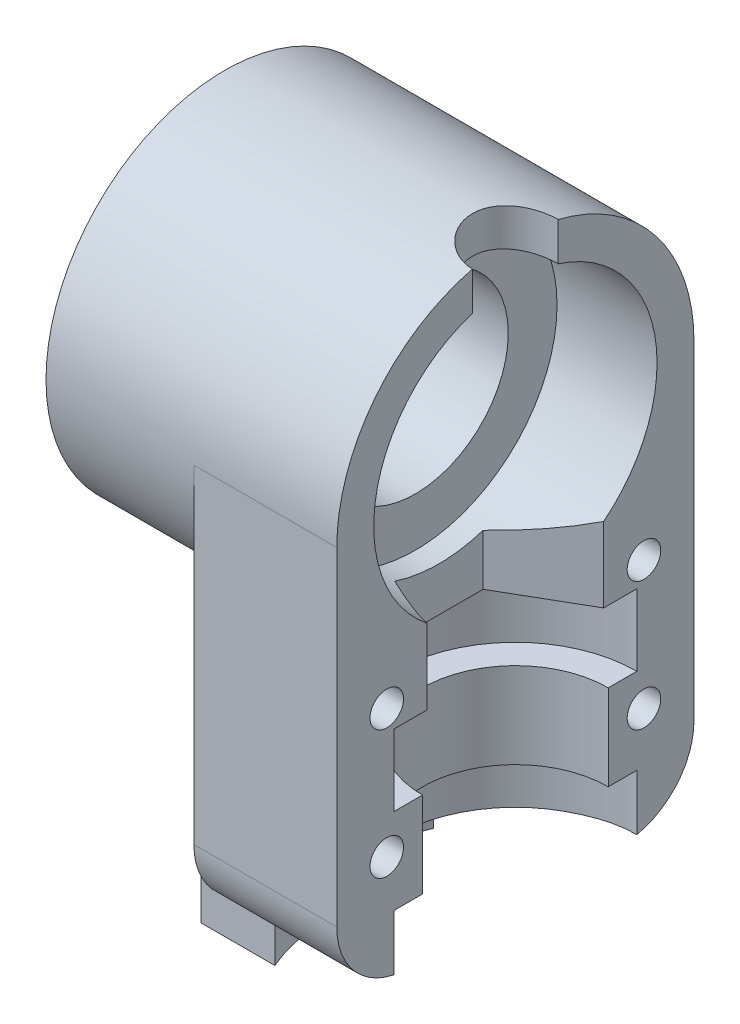
from build123d import *

# Parameters (mm, degrees)
CROQUIS1_W              = 10
CROQUIS1_H              = 25
SALIENTE_EXTRUIR1_DEPTH = 28
CROQUIS2_R              = 12.5
SALIENTE_EXTRUIR2_DEPTH = 12
REDONDEO1_R             = 5
CORTAR_EXTRUIR1_DEPTH   = 13
CROQUIS5_R              = 9.915
CORTAR_EXTRUIR2_DEPTH   = 7
CROQUIS8_R              = 1.175
CORTAR_EXTRUIR5_DEPTH   = 50.08411164
CROQUIS10_W             = 7
CROQUIS10_H             = 15
SALIENTE_EXTRUIR3_DEPTH = 5
CORTAR_EXTRUIR6_DEPTH   = 7
CORTAR_EXTRUIR7_DEPTH   = 3.85
CHAFL_N1_SIZE           = 4.3
CHAFL_N1_SIZE2          = 5.124540448
REDONDEO2_R             = 1
CORTAR_EXTRUIR8_DEPTH   = 4
REDONDEO3_R             = 3
CROQUIS14_R             = 12.5
CROQUIS14_R_2           = 11.25
SALIENTE_EXTRUIR4_DEPTH = 7.35
CROQUIS15_R             = 12.5
CROQUIS15_R_2           = 11
SALIENTE_EXTRUIR5_DEPTH = 1
CHAFL_N2_SIZE           = 0.5
CHAFL_N3_SIZE           = 0.5
CROQUIS16_R             = 6.5
CORTAR_EXTRUIR9_DEPTH   = 50.43149313


# Some blends are built 0.0001 mm under size
with BuildPart() as part:
    # Croquis1 → Saliente-Extruir1 (new body)
    with BuildSketch(Plane(origin=(0, 0, 0), x_dir=(1, 0, 0), z_dir=(0, 1, 0))):
        with Locations((-5, 12.5)):
            Rectangle(CROQUIS1_W, CROQUIS1_H)
    extrude(amount=SALIENTE_EXTRUIR1_DEPTH)

    # Croquis2 → Saliente-Extruir2 (add)
    with BuildSketch(Plane(origin=(0, 0, 0), x_dir=(0, 0, -1), z_dir=(1, 0, 0))):
        with Locations((12.5, 28)):
            Circle(CROQUIS2_R)
    extrude(amount=-SALIENTE_EXTRUIR2_DEPTH)

    # Croquis3 → Cortar-Revolución1 (revolve, cut)
    with BuildSketch(Plane(origin=(0, 0, 0), x_dir=(0, 0, -1), z_dir=(1, 0, 0))):
        Polygon((21, 0.5), (21, 4), (19, 4), (19, 10), (21, 10), (21, 15), (15.5, 15), (15.5, 41), (12.5, 41), (12.5, 0), (21, 0), align=None)
    revolve(axis=Axis((0, 0, -12.5), (0, 1, 0)), mode=Mode.SUBTRACT)

    # Redondeo1
    redondeo1_edges = [part.edges().sort_by_distance(p)[0] for p in [
        (-5, 0, -25),
        (-5, 0, 0),
    ]]
    fillet(redondeo1_edges, radius=REDONDEO1_R)

    # Croquis4 → Cortar-Extruir1 (cut)
    with BuildSketch(Plane.XZ.offset(-15)):
        Polygon((0, -18.67764788), (5.35, -15.58882394), (5.35, -9.41117606), (0, -6.32235212), (-5.35, -9.41117606), (-5.35, -15.58882394), align=None)
    extrude(amount=-CORTAR_EXTRUIR1_DEPTH, mode=Mode.SUBTRACT)

    # Croquis5 → Cortar-Extruir2 (cut)
    with BuildSketch(Plane(origin=(0, 0, 0), x_dir=(0, 0, -1), z_dir=(1, 0, 0))):
        with Locations((12.5, 28)):
            Circle(CROQUIS5_R)
    extrude(amount=-CORTAR_EXTRUIR2_DEPTH, mode=Mode.SUBTRACT)

    # Croquis8 → Cortar-Extruir5 (cut, through all)
    with BuildSketch(Plane(origin=(0, 0, 0), x_dir=(0, 0, -1), z_dir=(1, 0, 0))):
        with Locations((21.5, 16.5)):
            Circle(CROQUIS8_R)
        with Locations((3.5, 16.5)):
            Circle(CROQUIS8_R)
        with Locations((3.5, 7.5)):
            Circle(CROQUIS8_R)
        with Locations((21.5, 7.5)):
            Circle(CROQUIS8_R)
    extrude(amount=-CORTAR_EXTRUIR5_DEPTH, mode=Mode.SUBTRACT)

    # Croquis10 → Saliente-Extruir3 (add, symmetric)
    with BuildSketch(Plane.XY.offset(-12.5)):
        with Locations((-13.5, 0.5)):
            Rectangle(CROQUIS10_W, CROQUIS10_H)
    extrude(amount=SALIENTE_EXTRUIR3_DEPTH, both=True)

    # Croquis11 → Cortar-Extruir6 (cut)
    with BuildSketch(Plane.XZ.offset(7)):
        with BuildLine():
            Line((-10.743486399, -17.5), (-10, -17.5))
            Line((-10, -17.5), (-10, -7.5))
            Line((-10, -7.5), (-10.743486399, -7.5))
            ThreePointArc((-10.743486399, -7.5), (-11.85, -12.5), (-10.743486399, -17.5))
        make_face()
    extrude(amount=-CORTAR_EXTRUIR6_DEPTH, mode=Mode.SUBTRACT)

    # Croquis12 → Cortar-Extruir7 (cut)
    with BuildSketch(Plane.XZ.offset(7)):
        with BuildLine():
            Line((-13.787722048, -17.5), (-10.743486399, -17.5))
            ThreePointArc((-10.743486399, -17.5), (-11.85, -12.5), (-10.743486399, -7.5))
            Line((-10.743486399, -7.5), (-11.837335004, -7.5))
            ThreePointArc((-11.837335004, -7.5), (-12.358868803, -8.981355103), (-12.6958, -10.515267686))
            Line((-12.6958, -10.515267686), (-13.787722048, -17.5))
        make_face()
    extrude(amount=-CORTAR_EXTRUIR7_DEPTH, mode=Mode.SUBTRACT)

    # Chaflán1
    chafl_n1_edges = [part.edges().sort_by_distance(p)[0] for p in [
        (-17, 8, -12.5),
    ]]
    chafl_n1_side = [part.faces().sort_by_distance(p)[0] for p in [
        (-13.5, 8, -12.5),
    ]]
    chamfer(chafl_n1_edges, length=CHAFL_N1_SIZE, length2=CHAFL_N1_SIZE2, reference=chafl_n1_side[0])

    # Redondeo2
    redondeo2_edges = [part.edges().sort_by_distance(p)[0] for p in [
        (-12.358868803, -3.15, -8.981355103),
        (-13.241761024, -3.15, -14.007633843),
    ]]
    fillet(redondeo2_edges, radius=REDONDEO2_R - 0.0001)  # a hair under: the kernel refuses the full size

    # Croquis13 → Cortar-Extruir8 (cut)
    with BuildSketch(Plane.ZY.offset(10)):
        Polygon((-21.5, 18.830940108), (-23.518653348, 17.665470054), (-23.518653348, 15.334529946), (-21.5, 14.169059892), (-19.481346652, 15.334529946), (-19.481346652, 17.665470054), align=None)
        Polygon((-3.5, 18.830940108), (-5.518653348, 17.665470054), (-5.518653348, 15.334529946), (-3.5, 14.169059892), (-1.481346652, 15.334529946), (-1.481346652, 17.665470054), align=None)
        Polygon((-3.5, 9.830940108), (-5.518653348, 8.665470054), (-5.518653348, 6.334529946), (-3.5, 5.169059892), (-1.481346652, 6.334529946), (-1.481346652, 8.665470054), align=None)
        Polygon((-21.5, 9.830940108), (-23.518653348, 8.665470054), (-23.518653348, 6.334529946), (-21.5, 5.169059892), (-19.481346652, 6.334529946), (-19.481346652, 8.665470054), align=None)
    extrude(amount=-CORTAR_EXTRUIR8_DEPTH, mode=Mode.SUBTRACT)

    # Redondeo3
    redondeo3_edges = [part.edges().sort_by_distance(p)[0] for p in [
        (-17, 2.875459552, -12.5),
        (-12.7, 8, -12.5),
    ]]
    fillet(redondeo3_edges, radius=REDONDEO3_R)

    # Croquis14 → Saliente-Extruir4 (add)
    with BuildSketch(Plane.ZY.offset(12)):
        with Locations((-12.5, 28)):
            Circle(CROQUIS14_R)
        with Locations((-12.5, 28)):
            Circle(CROQUIS14_R_2, mode=Mode.SUBTRACT)
    extrude(amount=SALIENTE_EXTRUIR4_DEPTH)

    # Croquis15 → Saliente-Extruir5 (add)
    with BuildSketch(Plane.ZY.offset(19.35)):
        with Locations((-12.5, 28)):
            Circle(CROQUIS15_R)
        with Locations((-12.5, 28)):
            Circle(CROQUIS15_R_2, mode=Mode.SUBTRACT)
    extrude(amount=SALIENTE_EXTRUIR5_DEPTH)

    # Chaflán2
    chafl_n2_edges = [part.edges().sort_by_distance(p)[0] for p in [
        (-20.35, 28, -23.5),
    ]]
    chamfer(chafl_n2_edges, length=CHAFL_N2_SIZE)

    # Chaflán3
    # the kernel refuses this chamfer: 0.5 mm, written as the material it takes off along each edge
    with BuildSketch(Plane(origin=(-19.35, 28, -12.5), x_dir=(0, 0, 1), z_dir=(0, -1, 0))) as chafl_n3_piece_1_section:
        Polygon((11, CHAFL_N3_SIZE), (11 + CHAFL_N3_SIZE, 0), (11, 0), align=None)
    chafl_n3_piece_1 = revolve(axis=Axis((-19.35, 28, -12.5), (-1, 0, 0)), mode=Mode.PRIVATE)
    chafl_n3_piece_1 = chafl_n3_piece_1 & Plane(origin=(-19.718458847, 28, -12.5), x_dir=(0, 0, 1), z_dir=(1, 0, 0)) * Cylinder(11.25, 46, mode=Mode.PRIVATE)
    add(chafl_n3_piece_1, mode=Mode.SUBTRACT)

    # Croquis16 → Cortar-Extruir9 (cut, through all)
    with BuildSketch(Plane(origin=(-7, 0, 0), x_dir=(0, 0, -1), z_dir=(1, 0, 0))):
        with Locations((12.5, 28)):
            Circle(CROQUIS16_R)
    extrude(amount=-CORTAR_EXTRUIR9_DEPTH, mode=Mode.SUBTRACT)


solid = part.part
